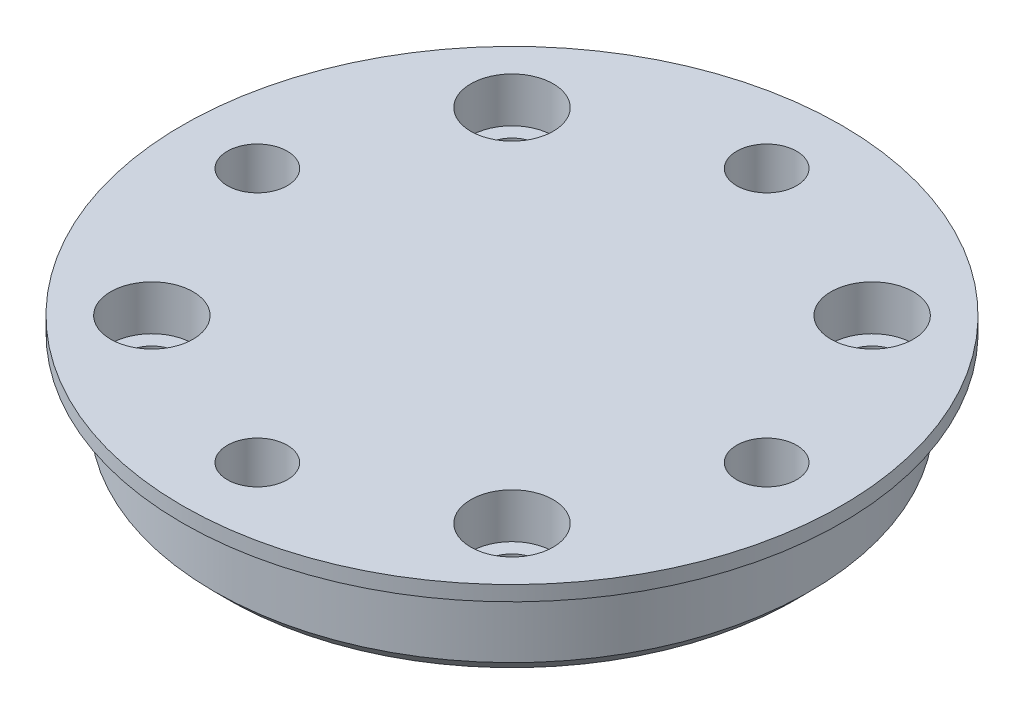
from build123d import *

# Parameters (mm, degrees)
SKETCH1_R           = 19.9
BOSS_EXTRUDE1_DEPTH = 6
SKETCH2_R           = 22
BOSS_EXTRUDE2_DEPTH = 1
SKETCH3_R           = 2
SKETCH3_R_2         = 1.75
CUT_EXTRUDE1_DEPTH  = 32.890437438
SKETCH5_R           = 2.75
SKETCH5_R_2         = 1.75
CUT_EXTRUDE2_DEPTH  = 3
CHAMFER1_SIZE       = 1


with BuildPart() as part:
    # Sketch1 → Boss-Extrude1 (new body)
    with BuildSketch(Plane(origin=(0, 0, 0), x_dir=(1, 0, 0), z_dir=(0, 1, 0))):
        with Locations(Location((0, 0, 0), (0, 0, 270))):
            Circle(SKETCH1_R)
    extrude(amount=BOSS_EXTRUDE1_DEPTH)

    # Sketch2 → Boss-Extrude2 (add)
    with BuildSketch(Plane(origin=(0, 6, 0), x_dir=(1, 0, 0), z_dir=(0, 1, 0))):
        with Locations(Location((0, 0, 0), (0, 0, 270))):
            Circle(SKETCH2_R)
    extrude(amount=BOSS_EXTRUDE2_DEPTH)

    # Sketch3 → Cut-Extrude1 (cut, through all)
    with BuildSketch(Plane(origin=(0, 7, 0), x_dir=(1, 0, 0), z_dir=(0, 1, 0))):
        with Locations(Location((0, 17, 0), (0, 0, 270))):
            Circle(SKETCH3_R)
        with Locations(Location((17, 0, 0), (0, 0, 270))):
            Circle(SKETCH3_R)
        with Locations(Location((0, -17, 0), (0, 0, 270))):
            Circle(SKETCH3_R)
        with Locations(Location((-17, 0, 0), (0, 0, 270))):
            Circle(SKETCH3_R)
        with Locations(Location((-12.02081528, 12.02081528, 0), (0, 0, 270))):
            Circle(SKETCH3_R_2)
        with Locations(Location((12.02081528, 12.02081528, 0), (0, 0, 270))):
            Circle(SKETCH3_R_2)
        with Locations(Location((12.02081528, -12.02081528, 0), (0, 0, 270))):
            Circle(SKETCH3_R_2)
        with Locations(Location((-12.02081528, -12.02081528, 0), (0, 0, 270))):
            Circle(SKETCH3_R_2)
    extrude(amount=-CUT_EXTRUDE1_DEPTH, mode=Mode.SUBTRACT)

    # Sketch5 → Cut-Extrude2 (cut)
    # profile 1 of 4: a face of its own
    with BuildSketch(Plane(origin=(0, 7, 0), x_dir=(1, 0, 0), z_dir=(0, 1, 0))):
        with Locations(Location((-12.02081528, 12.02081528, 0), (0, 0, 270))):
            Circle(SKETCH5_R)
        with Locations(Location((-12.02081528, 12.02081528, 0), (0, 0, 270))):
            Circle(SKETCH5_R_2, mode=Mode.SUBTRACT)
    # profile 2 of 4: a face of its own
    with BuildSketch(Plane(origin=(0, 7, 0), x_dir=(1, 0, 0), z_dir=(0, 1, 0))):
        with Locations(Location((12.02081528, 12.02081528, 0), (0, 0, 270))):
            Circle(SKETCH5_R)
        with Locations(Location((12.02081528, 12.02081528, 0), (0, 0, 270))):
            Circle(SKETCH5_R_2, mode=Mode.SUBTRACT)
    # profile 3 of 4: a face of its own
    with BuildSketch(Plane(origin=(0, 7, 0), x_dir=(1, 0, 0), z_dir=(0, 1, 0))):
        with Locations(Location((12.02081528, -12.02081528, 0), (0, 0, 270))):
            Circle(SKETCH5_R)
        with Locations(Location((12.02081528, -12.02081528, 0), (0, 0, 270))):
            Circle(SKETCH5_R_2, mode=Mode.SUBTRACT)
    # profile 4 of 4: a face of its own
    with BuildSketch(Plane(origin=(0, 7, 0), x_dir=(1, 0, 0), z_dir=(0, 1, 0))):
        with Locations(Location((-12.02081528, -12.02081528, 0), (0, 0, 270))):
            Circle(SKETCH5_R)
        with Locations(Location((-12.02081528, -12.02081528, 0), (0, 0, 270))):
            Circle(SKETCH5_R_2, mode=Mode.SUBTRACT)
    extrude(amount=-CUT_EXTRUDE2_DEPTH, mode=Mode.SUBTRACT)

    # Chamfer1
    # the kernel refuses this chamfer: 1 mm, written as the material it takes off along each edge
    with BuildSketch(Plane(origin=(0, 0, 0), x_dir=(0, 0, 1), z_dir=(-1, 0, 0))) as chamfer1_piece_1:
        Polygon((19.9, CHAMFER1_SIZE), (19.9 - CHAMFER1_SIZE, 0), (19.9, 0), align=None)
    revolve(axis=Axis((0, 0, 0), (0, 1, 0)), mode=Mode.SUBTRACT)


solid = part.part
